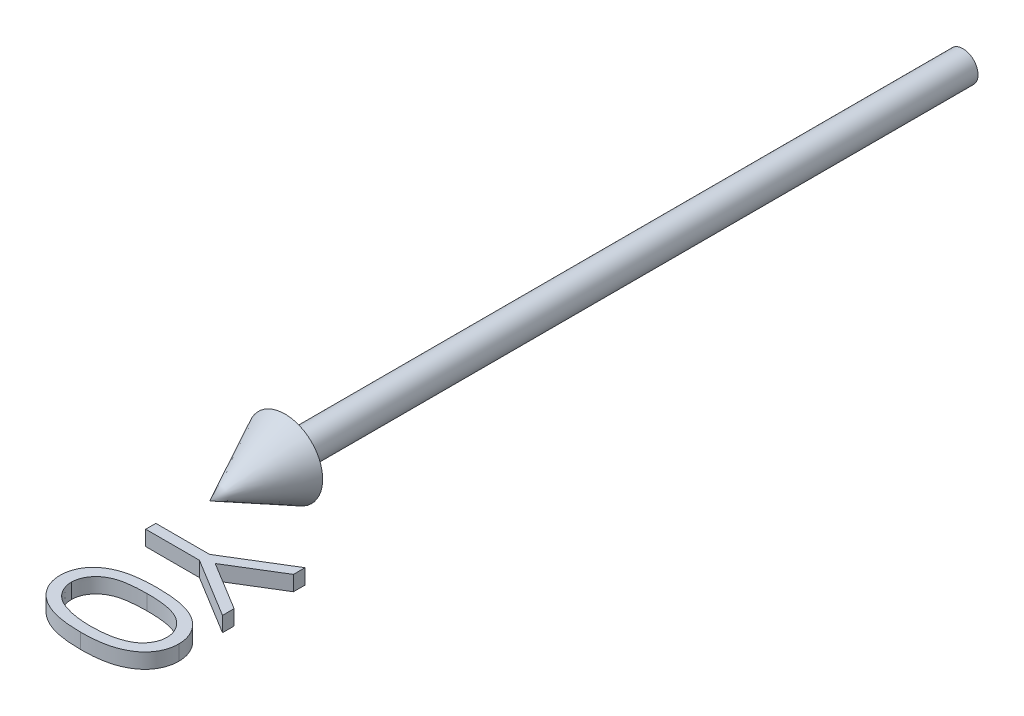
from build123d import *

# Parameters (mm, degrees)
BOSS_EXTRUDE1_DEPTH        = 1
BOSS_EXTRUDE1_DEPTH_BACK   = 1
BOSS_EXTRUDE1_2_DEPTH      = 1
BOSS_EXTRUDE1_2_DEPTH_BACK = 1


with BuildPart() as part:
    # Sketch2 → Revolve1 (revolve)
    with BuildSketch(Plane(origin=(0, 0, 0), x_dir=(1, 0, 0), z_dir=(0, 1, 0))):
        Polygon((0, -100), (5, -90), (2, -90), (2, 0), (0, 0), align=None)
    revolve(axis=Axis((0, 0, -41.949952025), (0, 0, 1)))


with BuildPart() as body_2:
    # Sketch3 → Boss-Extrude1 (new, two sides: drawn at the far end of the back side and taken through both)
    with BuildSketch(Plane(origin=(0, 0, 0), x_dir=(1, 0, 0), z_dir=(0, 1, 0)).offset(-BOSS_EXTRUDE1_DEPTH_BACK)):
        Polygon((15, -102.339799406), (15, -103.881265752), (8.5546875, -107.823573444), (15, -111.759871521), (15, -113.301337867), (7.130408654, -108.49364556), (0, -108.49364556), (0, -107.147491713), (7.130408654, -107.147491713), align=None)
    extrude(amount=BOSS_EXTRUDE1_DEPTH + BOSS_EXTRUDE1_DEPTH_BACK)


with BuildPart() as body_3:
    # Sketch3 → Boss-Extrude1 2 (new, two sides: drawn at the far end of the back side and taken through both)
    with BuildSketch(Plane(origin=(0, 0, 0), x_dir=(1, 0, 0), z_dir=(0, 1, 0)).offset(-BOSS_EXTRUDE1_2_DEPTH_BACK)):
        with BuildLine():
            add(Edge.make_bspline(
                [(7.493990385, -114.455184021), (7.734407761, -114.456589813), (8.201421979, -114.459320584), (8.881927587, -114.489699532), (9.520328829, -114.540165282), (10.116656244, -114.609325462), (10.67106384, -114.693488198), (11.182069829, -114.805840407), (11.652039951, -114.933609146), (12.082504599, -115.08169245), (12.479270571, -115.248778177), (12.849648816, -115.430656215), (13.193169112, -115.634445335), (13.51499205, -115.848846598), (13.811525932, -116.081694795), (14.082209196, -116.33053395), (14.327205285, -116.59783245), (14.549430068, -116.878303738), (14.743016183, -117.173720313), (14.917450141, -117.474975469), (15.060618757, -117.787385096), (15.178257413, -118.10809992), (15.272518287, -118.436187268), (15.33779376, -118.773002772), (15.378703934, -119.118627801), (15.382626206, -119.35190276), (15.384615385, -119.47020806)],
                knots=[0, 0, 0, 0, 1.646377244, 3.198111528, 4.663803227, 6.031090796, 7.308794487, 8.502186765, 9.612154809, 10.642545331, 11.617106989, 12.558866172, 13.465886467, 14.35053239, 15.20542558, 16.045215227, 16.865619885, 17.686225247, 18.492864914, 19.282407821, 20.068097601, 20.842842034, 21.620163247, 22.403093475, 23.190129512, 24, 24, 24, 24], degree=3))
            add(Edge.make_bspline(
                [(15.384615385, -119.47020806), (15.382524748, -119.589502967), (15.37836713, -119.826743006), (15.338407376, -120.177487471), (15.272102563, -120.520128964), (15.178155529, -120.853206701), (15.061602629, -121.179456643), (14.915514984, -121.496326962), (14.745462696, -121.805785883), (14.545646079, -122.102915687), (14.322864895, -122.390978324), (14.071024886, -122.662898165), (13.792668946, -122.918699962), (13.490775244, -123.161594128), (13.159553452, -123.384689544), (12.80476441, -123.597147111), (12.42020356, -123.787312979), (12.01228727, -123.970461587), (11.569728732, -124.128548673), (11.095022615, -124.271118296), (10.582561815, -124.386313875), (10.035035049, -124.4822679), (9.450431549, -124.556603168), (8.830004483, -124.610743063), (8.173345666, -124.639341999), (7.724383455, -124.644727861), (7.493990385, -124.647491713)],
                knots=[0, 0, 0, 0, 0.810914788, 1.612654377, 2.396697861, 3.181598691, 3.963628158, 4.749916497, 5.551656086, 6.361998678, 7.18212741, 8.025565596, 8.878627764, 9.750805457, 10.657531673, 11.591944965, 12.560506719, 13.57287815, 14.630710178, 15.753379473, 16.941251878, 18.199788006, 19.531962791, 20.947069417, 22.433333509, 24, 24, 24, 24], degree=3))
            add(Edge.make_bspline(
                [(7.493990385, -124.647491713), (7.264603065, -124.644695757), (6.817651229, -124.639247949), (6.163935199, -124.611101175), (5.546842359, -124.55539666), (4.964654956, -124.486498964), (4.420829624, -124.388355147), (3.910195243, -124.276782922), (3.437158505, -124.138110625), (2.996933984, -123.982178272), (2.59101622, -123.803003807), (2.209779717, -123.611157225), (1.855280169, -123.400003766), (1.524063192, -123.175577859), (1.219551287, -122.934748264), (0.940991864, -122.677863297), (0.688568659, -122.40472743), (0.462743585, -122.116013514), (0.265252974, -121.81420944), (0.088728132, -121.505783455), (-0.05451083, -121.184579651), (-0.175450263, -120.857736525), (-0.269613426, -120.522170099), (-0.334086308, -120.178209517), (-0.37942892, -119.826981239), (-0.382880577, -119.58954424), (-0.384615385, -119.47020806)],
                knots=[0, 0, 0, 0, 1.56130642, 3.042141888, 4.451772327, 5.777565838, 7.030558081, 8.211376819, 9.333164717, 10.383253789, 11.387583522, 12.350962576, 13.286244149, 14.193812918, 15.072134482, 15.925989337, 16.770211267, 17.600669898, 18.417446232, 19.22325363, 20.01647746, 20.807971184, 21.593601364, 22.38506573, 23.188331689, 24, 24, 24, 24], degree=3))
            add(Edge.make_bspline(
                [(-0.384615385, -119.47020806), (-0.382607064, -119.351907566), (-0.378647048, -119.118642084), (-0.338013359, -118.772947633), (-0.271753502, -118.436657426), (-0.181772946, -118.109099197), (-0.067412994, -117.78960259), (0.078048627, -117.481297389), (0.246761479, -117.180111945), (0.438703921, -116.887420574), (0.658664961, -116.6088018), (0.901935338, -116.3426593), (1.174616769, -116.095713069), (1.47234457, -115.865783202), (1.792592519, -115.647592243), (2.138515298, -115.445800108), (2.512363768, -115.264276831), (2.911320013, -115.093446575), (3.34494836, -114.942860027), (3.81742511, -114.810847312), (4.33136389, -114.700796247), (4.88523897, -114.61229261), (5.479464905, -114.539330265), (6.115087943, -114.489938494), (6.791559687, -114.459296391), (7.255574099, -114.456579826), (7.493990385, -114.455184021)],
                knots=[0, 0, 0, 0, 0.810940842, 1.599017053, 2.38298203, 3.159479784, 3.926441347, 4.70693857, 5.494146311, 6.292334103, 7.104379492, 7.925868426, 8.762126819, 9.623561095, 10.503686106, 11.41783325, 12.366995289, 13.351843594, 14.392337808, 15.512229747, 16.713911458, 17.994391108, 19.357476964, 20.818259213, 22.365182633, 24, 24, 24, 24], degree=3))
        make_face()
        with BuildLine():
            add(Edge.make_bspline(
                [(7.5, -115.801337867), (7.299648434, -115.801849783), (6.910805384, -115.802843312), (6.345762838, -115.828798458), (5.81874714, -115.864156591), (5.329089137, -115.909762163), (4.878446191, -115.977489045), (4.463719097, -116.053375412), (4.087101973, -116.145723929), (3.746012653, -116.254989736), (3.434655082, -116.379438084), (3.14495103, -116.51533756), (2.873388081, -116.6612512), (2.622724417, -116.824835863), (2.390464856, -117.002381096), (2.177276851, -117.194178441), (1.984090593, -117.399890583), (1.754856367, -117.684663622), (1.515171332, -118.058765632), (1.309023902, -118.532537782), (1.17863499, -119.019572295), (1.16209952, -119.350235779), (1.153846154, -119.515280175)],
                knots=[0, 0, 0, 0, 1.459116078, 2.831857795, 4.118796693, 5.306371758, 6.412361096, 7.436813035, 8.376339383, 9.234574298, 10.043323891, 10.816788787, 11.564361537, 12.286735248, 12.994408768, 13.691741332, 14.372975427, 15.047457468, 16.352811911, 17.594285292, 18.799233213, 20, 20, 20, 20], degree=3))
            add(Edge.make_bspline(
                [(1.153846154, -119.515280175), (1.160693786, -119.681384482), (1.174374912, -120.013250153), (1.306369501, -120.498109275), (1.50552467, -120.968810432), (1.741013979, -121.337690176), (1.965278248, -121.618329649), (2.156483884, -121.819402463), (2.370580458, -122.0039541), (2.60157744, -122.178991563), (2.853888087, -122.339530459), (3.126299124, -122.485515335), (3.419567029, -122.618729681), (3.624294482, -122.694625593), (3.728966346, -122.733429213)],
                knots=[0, 0, 0, 0, 1.353760809, 2.704726607, 4.075137775, 5.516104923, 6.260822281, 7.007110065, 7.778089737, 8.566572457, 9.372053459, 10.217411131, 11.088608312, 12, 12, 12, 12], degree=3))
            add(Edge.make_bspline(
                [(3.728966346, -122.733429213), (3.862808087, -122.778651075), (4.134564219, -122.870470849), (4.556122728, -122.988807024), (4.998420288, -123.082001592), (5.458813645, -123.165844589), (5.940698078, -123.223071971), (6.442582581, -123.269134028), (6.964845562, -123.296265543), (7.319681238, -123.299628762), (7.5, -123.301337867)],
                knots=[0, 0, 0, 0, 0.884706709, 1.796334032, 2.740027952, 3.714592787, 4.726048262, 5.777819803, 6.87074269, 8, 8, 8, 8], degree=3))
            add(Edge.make_bspline(
                [(7.5, -123.301337867), (7.680314886, -123.299452907), (8.033092983, -123.295765066), (8.549207658, -123.271535617), (9.04026198, -123.232600906), (9.50670142, -123.179903628), (9.947695768, -123.107561411), (10.363876079, -123.020685607), (10.755130158, -122.918833696), (11.122467014, -122.802006517), (11.464566341, -122.670343904), (11.782172956, -122.524896195), (12.076970622, -122.369683782), (12.348113155, -122.201068237), (12.596824432, -122.021088233), (12.818115455, -121.824984071), (13.018845343, -121.620536855), (13.247970631, -121.334177457), (13.481592187, -120.959287658), (13.696588299, -120.492806308), (13.820052411, -120.007360691), (13.837459641, -119.679188744), (13.846153846, -119.515280175)],
                knots=[0, 0, 0, 0, 1.313668642, 2.570134578, 3.763346207, 4.902004944, 5.98888779, 7.017888835, 7.998425394, 8.933058446, 9.82474457, 10.667209444, 11.476765193, 12.250262638, 12.991704352, 13.7104269, 14.401925311, 15.076585796, 16.378385137, 17.609787933, 18.806186071, 20, 20, 20, 20], degree=3))
            add(Edge.make_bspline(
                [(13.846153846, -119.515280175), (13.837458863, -119.349370671), (13.820053056, -119.017249416), (13.696912054, -118.52686371), (13.483593851, -118.057059393), (13.246461982, -117.685177299), (13.022901506, -117.399179198), (12.828492468, -117.197224609), (12.614659534, -117.008418097), (12.383383302, -116.830724947), (12.132593212, -116.667297758), (11.861069755, -116.521324404), (11.571338781, -116.385502937), (11.26005205, -116.260787406), (10.918448517, -116.152534208), (10.543732141, -116.055775818), (10.128617676, -115.97993549), (9.676714853, -115.913754009), (9.186454905, -115.863294382), (8.658224188, -115.828889226), (8.092204505, -115.80279635), (7.701355185, -115.801833765), (7.5, -115.801337867)],
                knots=[0, 0, 0, 0, 1.207964612, 2.418129846, 3.655795183, 4.951004962, 5.620895151, 6.296795572, 6.989224116, 7.696855977, 8.419187164, 9.166715907, 9.940135271, 10.748837255, 11.607021648, 12.548275234, 13.5654991, 14.678641405, 15.874140913, 17.15372626, 18.533675393, 20, 20, 20, 20], degree=3))
        make_face(mode=Mode.SUBTRACT)
    extrude(amount=BOSS_EXTRUDE1_2_DEPTH + BOSS_EXTRUDE1_2_DEPTH_BACK)


solid = Compound([part.part, body_2.part, body_3.part])
